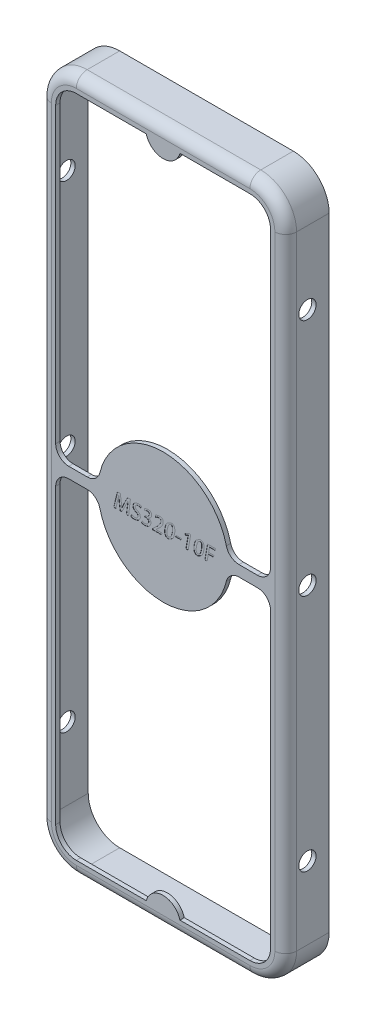
from build123d import *

# Parameters (mm, degrees)
BOSS_EXTRUDE1_DEPTH     = 2
FILLET1_R               = 0.5
SHELL1_T                = -0.2
CUT_EXTRUDE1_DEPTH      = 18.085739668
CUT_EXTRUDE2_DEPTH      = 18.08573968
CUT_EXTRUDE2_DEPTH_BACK = 18.08573968
SKETCH3_R               = 0.4
BOSS_EXTRUDE2_DEPTH     = 0.2
WRAP1_START             = -0.01
WRAP1_DEPTH             = 0.01


# Read off the part's stored shape, not the designer's step: Wrap1
with BuildPart() as part:
    # Sketch1 → Boss-Extrude1 (new body)
    with BuildSketch(Plane.XY):
        with BuildLine():
            Line((-4, 16), (4, 16))
            ThreePointArc((4, 16), (5.166726189, 15.516726189), (5.65, 14.35))
            Line((5.65, 14.35), (5.65, -14.35))
            ThreePointArc((5.65, -14.35), (5.166726189, -15.516726189), (4, -16))
            Line((4, -16), (-4, -16))
            ThreePointArc((-4, -16), (-5.166726189, -15.516726189), (-5.65, -14.35))
            Line((-5.65, -14.35), (-5.65, 14.35))
            ThreePointArc((-5.65, 14.35), (-5.166726189, 15.516726189), (-4, 16))
        make_face()
    extrude(amount=BOSS_EXTRUDE1_DEPTH)

    # Fillet1
    fillet1_edges = [part.edges().sort_by_distance(p)[0] for p in [
        (5.166726189, -15.516726189, 2),
        (5.65, 0, 2),
        (5.166726189, 15.516726189, 2),
        (0, 16, 2),
        (-5.166726189, 15.516726189, 2),
        (-5.65, 0, 2),
        (-5.166726189, -15.516726189, 2),
        (0, -16, 2),
    ]]
    fillet(fillet1_edges, radius=FILLET1_R)

    # Shell1
    shell1_openings = [part.faces().sort_by_distance(p)[0] for p in [
        (0, 0, 0),
    ]]
    offset(amount=SHELL1_T, openings=shell1_openings, kind=Kind.INTERSECTION)

    # Sketch2 → Cut-Extrude1 (cut, through all)
    with BuildSketch(Plane.XY.offset(2)):
        with BuildLine():
            Line((-4.35, 0.25), (-3.49821383, 0.25))
            ThreePointArc((-3.49821383, 0.25), (-3.127403906, 0.378300943), (-2.915178192, 0.708333333))
            ThreePointArc((-2.915178192, 0.708333333), (0, 3), (2.915178192, 0.708333333))
            ThreePointArc((2.915178192, 0.708333333), (3.127403906, 0.378300943), (3.49821383, 0.25))
            Line((3.49821383, 0.25), (4.35, 0.25))
            ThreePointArc((4.35, 0.25), (4.774264069, 0.425735931), (4.95, 0.85))
            Line((4.95, 0.85), (4.95, 14.35))
            ThreePointArc((4.95, 14.35), (4.671751442, 15.021751442), (4, 15.3))
            Line((4, 15.3), (-4, 15.3))
            ThreePointArc((-4, 15.3), (-4.671751442, 15.021751442), (-4.95, 14.35))
            Line((-4.95, 14.35), (-4.95, 0.85))
            ThreePointArc((-4.95, 0.85), (-4.774264069, 0.425735931), (-4.35, 0.25))
        make_face()
        with BuildLine():
            Line((-4, -15.3), (4, -15.3))
            ThreePointArc((4, -15.3), (4.671751442, -15.021751442), (4.95, -14.35))
            Line((4.95, -14.35), (4.95, -0.85))
            ThreePointArc((4.95, -0.85), (4.774264069, -0.425735931), (4.35, -0.25))
            Line((4.35, -0.25), (3.49821383, -0.25))
            ThreePointArc((3.49821383, -0.25), (3.127403906, -0.378300943), (2.915178192, -0.708333333))
            ThreePointArc((2.915178192, -0.708333333), (0, -3), (-2.915178192, -0.708333333))
            ThreePointArc((-2.915178192, -0.708333333), (-3.127403906, -0.378300943), (-3.49821383, -0.25))
            Line((-3.49821383, -0.25), (-4.35, -0.25))
            ThreePointArc((-4.35, -0.25), (-4.774264069, -0.425735931), (-4.95, -0.85))
            Line((-4.95, -0.85), (-4.95, -14.35))
            ThreePointArc((-4.95, -14.35), (-4.671751442, -15.021751442), (-4, -15.3))
        make_face()
    extrude(amount=-CUT_EXTRUDE1_DEPTH, mode=Mode.SUBTRACT)

    # Sketch3 → Cut-Extrude2 (cut, two sides: drawn at the far end of the back side and taken through both)
    with BuildSketch(Plane(origin=(0, 0, 0), x_dir=(0, 0, -1), z_dir=(1, 0, 0)).offset(-CUT_EXTRUDE2_DEPTH_BACK)):
        with Locations((-1, 0)):
            Circle(SKETCH3_R)
        with Locations((-1, 11)):
            Circle(SKETCH3_R)
        with Locations(Location((-1, -11, 0), (0, 0, 90))):
            Circle(SKETCH3_R)
    extrude(amount=CUT_EXTRUDE2_DEPTH + CUT_EXTRUDE2_DEPTH_BACK, mode=Mode.SUBTRACT)

    # Sketch4 → Boss-Extrude2 (add)
    with BuildSketch(Plane.XY.offset(2)):
        with BuildLine():
            Line((-0.8, 15.5), (0.8, 15.5))
            ThreePointArc((0.8, 15.5), (0, 14.7), (-0.8, 15.5))
        make_face()
        with BuildLine():
            Line((-0.8, -15.5), (0.8, -15.5))
            ThreePointArc((0.8, -15.5), (0, -14.7), (-0.8, -15.5))
        make_face()
    extrude(amount=-BOSS_EXTRUDE2_DEPTH)

    # Wrap1 outline → Wrap1 (cut)
    # profile 1 of 9: a face of its own
    with BuildSketch(Plane.XY.offset(2).offset(WRAP1_START)):
        with BuildLine():
            add(Edge.make_bspline(
                [(1.586144602, -0.357738226), (1.54802343, -0.351061654), (1.471618295, -0.337679999), (1.402972828, -0.1895203), (1.417919962, -0.079096155), (1.427910316, -0.005290942)],
                knots=[0, 0, 0, 0, 0.248239325, 0.497538725, 1, 1, 1, 1], degree=3))
            add(Edge.make_bspline(
                [(1.875397171, 0.002116467), (1.861269185, -0.074159773), (1.829992471, -0.243021071), (1.672497571, -0.317113852), (1.586144602, -0.357738226)],
                knots=[0, 0, 0, 0, 0.451709428, 1, 1, 1, 1], degree=3))
            add(Edge.make_bspline(
                [(1.718518836, 0.351851981), (1.756506472, 0.345450056), (1.832596862, 0.332626805), (1.900697575, 0.185099108), (1.885534609, 0.075434474), (1.875397171, 0.002116467)],
                knots=[0, 0, 0, 0, 0.248365009, 0.497482668, 1, 1, 1, 1], degree=3))
            add(Edge.make_bspline(
                [(1.427910316, -0.005290942), (1.442568806, 0.070496461), (1.475057404, 0.238469194), (1.632249849, 0.311675523), (1.718518836, 0.351851981)],
                knots=[0, 0, 0, 0, 0.451188722, 1, 1, 1, 1], degree=3))
        make_face()
        with BuildLine():
            add(Edge.make_bspline(
                [(1.535450019, -0.001587237), (1.528074164, -0.053457192), (1.517022814, -0.131174696), (1.531092484, -0.222447793), (1.562950436, -0.267960549), (1.589432881, -0.272348176), (1.602643344, -0.274536894)],
                knots=[0, 0, 0, 0, 0.501579369, 0.751523632, 0.876050416, 1, 1, 1, 1], degree=3))
            add(Edge.make_bspline(
                [(1.700132589, 0.268650908), (1.673725419, 0.258616582), (1.620239215, 0.238292631), (1.566744759, 0.133738649), (1.547970796, 0.052555576), (1.535450019, -0.001587237)],
                knots=[0, 0, 0, 0, 0.245176773, 0.496591442, 1, 1, 1, 1], degree=3))
            add(Edge.make_bspline(
                [(1.767725194, -0.001587237), (1.775036234, 0.049911485), (1.785987013, 0.127048403), (1.774270915, 0.219530589), (1.739705572, 0.262861041), (1.713326289, 0.266720556), (1.700132589, 0.268650908)],
                knots=[0, 0, 0, 0, 0.501619385, 0.751346284, 0.875634888, 1, 1, 1, 1], degree=3))
            add(Edge.make_bspline(
                [(1.602643344, -0.274536894), (1.630093794, -0.265403868), (1.685590896, -0.246939456), (1.736559298, -0.138207782), (1.755252722, -0.056262254), (1.767725194, -0.001587237)],
                knots=[0, 0, 0, 0, 0.245689514, 0.4967152, 1, 1, 1, 1], degree=3))
        make_face(mode=Mode.SUBTRACT)
    # profile 2 of 9: a face of its own
    with BuildSketch(Plane.XY.offset(2).offset(WRAP1_START)):
        with BuildLine():
            add(Edge.make_bspline(
                [(1.153743444, 0.243121544), (1.131869725, 0.232516701), (1.088613787, 0.211545306), (1.045718109, 0.189846597), (1.024513975, 0.17912052)],
                knots=[0, 0, 0, 0, 0.505681314, 1, 1, 1, 1], degree=3))
            Line((1.153743444, 0.243121544), (1.049440349, -0.348430783))
            Line((1.049440349, -0.348430783), (1.152572861, -0.349470899))
            Line((1.152572861, -0.349470899), (1.273292155, 0.335185182))
            Line((1.273292155, 0.335185182), (1.18369072, 0.335185182))
            Line((1.18369072, 0.335185182), (1.014324008, 0.256149485))
            Line((1.014324008, 0.256149485), (1.024513975, 0.17912052))
        make_face()
    # profile 3 of 9: a face of its own
    with BuildSketch(Plane.XY.offset(2).offset(WRAP1_START)):
        with BuildLine():
            add(Edge.make_bspline(
                [(0.240112607, -0.357738226), (0.201991436, -0.351061654), (0.1255863, -0.337679999), (0.056940833, -0.1895203), (0.071887967, -0.079096155), (0.081878322, -0.005290942)],
                knots=[0, 0, 0, 0, 0.248239325, 0.497538725, 1, 1, 1, 1], degree=3))
            add(Edge.make_bspline(
                [(0.529365177, 0.002116467), (0.51523719, -0.074159773), (0.483960476, -0.243021071), (0.326465576, -0.317113852), (0.240112607, -0.357738226)],
                knots=[0, 0, 0, 0, 0.451709428, 1, 1, 1, 1], degree=3))
            add(Edge.make_bspline(
                [(0.372486841, 0.351851981), (0.410474477, 0.345450056), (0.486564867, 0.332626805), (0.55466558, 0.185099108), (0.539502615, 0.075434474), (0.529365177, 0.002116467)],
                knots=[0, 0, 0, 0, 0.248365009, 0.497482668, 1, 1, 1, 1], degree=3))
            add(Edge.make_bspline(
                [(0.081878322, -0.005290942), (0.096536811, 0.070496461), (0.12902541, 0.238469194), (0.286217855, 0.311675523), (0.372486841, 0.351851981)],
                knots=[0, 0, 0, 0, 0.451188722, 1, 1, 1, 1], degree=3))
        make_face()
        with BuildLine():
            add(Edge.make_bspline(
                [(0.189418024, -0.001587237), (0.18204217, -0.053457192), (0.17099082, -0.131174696), (0.185060489, -0.222447793), (0.216918442, -0.267960549), (0.243400886, -0.272348176), (0.25661135, -0.274536894)],
                knots=[0, 0, 0, 0, 0.501579369, 0.751523632, 0.876050416, 1, 1, 1, 1], degree=3))
            add(Edge.make_bspline(
                [(0.354100594, 0.268650908), (0.327693424, 0.258616582), (0.274207221, 0.238292631), (0.220712764, 0.133738649), (0.201938802, 0.052555576), (0.189418024, -0.001587237)],
                knots=[0, 0, 0, 0, 0.245176773, 0.496591442, 1, 1, 1, 1], degree=3))
            add(Edge.make_bspline(
                [(0.4216932, -0.001587237), (0.42900424, 0.049911485), (0.439955019, 0.127048403), (0.42823892, 0.219530589), (0.393673577, 0.262861041), (0.367294294, 0.266720556), (0.354100594, 0.268650908)],
                knots=[0, 0, 0, 0, 0.501619385, 0.751346284, 0.875634888, 1, 1, 1, 1], degree=3))
            add(Edge.make_bspline(
                [(0.25661135, -0.274536894), (0.2840618, -0.265403868), (0.339558901, -0.246939456), (0.390527304, -0.138207782), (0.409220728, -0.056262254), (0.4216932, -0.001587237)],
                knots=[0, 0, 0, 0, 0.245689514, 0.4967152, 1, 1, 1, 1], degree=3))
        make_face(mode=Mode.SUBTRACT)
    # profile 4 of 9: a face of its own
    with BuildSketch(Plane.XY.offset(2).offset(WRAP1_START)):
        with BuildLine():
            add(Edge.make_bspline(
                [(-0.330199869, -0.264211165), (-0.284138068, -0.264986038), (-0.191909327, -0.266537552), (-0.099668052, -0.266226825), (-0.053494838, -0.266071284)],
                knots=[0, 0, 0, 0, 0.499430003, 1, 1, 1, 1], degree=3))
            Line((-0.330199869, -0.264211165), (-0.263181834, -0.205617016))
            add(Edge.make_bspline(
                [(0.005555557, 0.152381045), (-0.003528599, 0.120035968), (-0.021705689, 0.055314561), (-0.080567733, -0.027515999), (-0.16066342, -0.114754189), (-0.224453177, -0.171291521), (-0.263181834, -0.205617016)],
                knots=[0, 0, 0, 0, 0.21964169, 0.439495608, 0.659701123, 1, 1, 1, 1], degree=3))
            add(Edge.make_bspline(
                [(-0.163095268, 0.351851981), (-0.113958927, 0.345225704), (-0.003663784, 0.33035186), (0.002266954, 0.215864459), (0.005555557, 0.152381045)],
                knots=[0, 0, 0, 0, 0.445498688, 1, 1, 1, 1], degree=3))
            add(Edge.make_bspline(
                [(-0.359656151, 0.289947208), (-0.333017746, 0.305672002), (-0.27253695, 0.341374142), (-0.202362052, 0.348092618), (-0.163095268, 0.351851981)],
                knots=[0, 0, 0, 0, 0.440444019, 1, 1, 1, 1], degree=3))
            Line((-0.359656151, 0.289947208), (-0.340996312, 0.213842232))
            add(Edge.make_bspline(
                [(-0.19880956, 0.268650908), (-0.221471, 0.265661515), (-0.273042607, 0.258858425), (-0.316586401, 0.230012671), (-0.340996312, 0.213842232)],
                knots=[0, 0, 0, 0, 0.439416987, 1, 1, 1, 1], degree=3))
            add(Edge.make_bspline(
                [(-0.102380971, 0.141269932), (-0.09985859, 0.171840916), (-0.094256225, 0.239740953), (-0.161720225, 0.258395367), (-0.19880956, 0.268650908)],
                knots=[0, 0, 0, 0, 0.450235164, 1, 1, 1, 1], degree=3))
            add(Edge.make_bspline(
                [(-0.390608538, -0.212169287), (-0.337813551, -0.168435573), (-0.218818125, -0.069863488), (-0.144002801, 0.065797809), (-0.102380971, 0.141269932)],
                knots=[0, 0, 0, 0, 0.443672404, 1, 1, 1, 1], degree=3))
            Line((-0.390608538, -0.212169287), (-0.476064748, -0.287737929))
            Line((-0.476064748, -0.287737929), (-0.48691454, -0.349272616))
            Line((-0.48691454, -0.349272616), (-0.068164979, -0.349272616))
            Line((-0.068164979, -0.349272616), (-0.053494838, -0.266071284))
        make_face()
    # profile 5 of 9: a face of its own
    with BuildSketch(Plane.XY.offset(2).offset(WRAP1_START)):
        with BuildLine():
            add(Edge.make_bspline(
                [(-1.031084846, 0.245899581), (-1.04744454, 0.254255371), (-1.084627892, 0.273246942), (-1.126447726, 0.275727397), (-1.149867937, 0.277116518)],
                knots=[0, 0, 0, 0, 0.439973597, 1, 1, 1, 1], degree=3))
            Line((-1.031084846, 0.245899581), (-0.990482057, 0.330362306))
            add(Edge.make_bspline(
                [(-1.132407616, 0.360317591), (-1.11081601, 0.35969247), (-1.061821949, 0.358273991), (-1.016070765, 0.340373871), (-0.990482057, 0.330362306)],
                knots=[0, 0, 0, 0, 0.440698443, 1, 1, 1, 1], degree=3))
            add(Edge.make_bspline(
                [(-1.393386501, 0.171693218), (-1.372350469, 0.220939791), (-1.324467032, 0.333037699), (-1.201405862, 0.350517162), (-1.132407616, 0.360317591)],
                knots=[0, 0, 0, 0, 0.439317497, 1, 1, 1, 1], degree=3))
            add(Edge.make_bspline(
                [(-1.254100761, -0.029232745), (-1.291422592, -0.01156234), (-1.374623624, 0.027830043), (-1.38671758, 0.120559692), (-1.393386501, 0.171693218)],
                knots=[0, 0, 0, 0, 0.448574143, 1, 1, 1, 1], degree=3))
            add(Edge.make_bspline(
                [(-1.158465822, -0.160317425), (-1.159925664, -0.133205437), (-1.163280446, -0.070900861), (-1.221318249, -0.044273273), (-1.254100761, -0.029232745)],
                knots=[0, 0, 0, 0, 0.435152433, 1, 1, 1, 1], degree=3))
            add(Edge.make_bspline(
                [(-1.307010823, -0.266666651), (-1.276175431, -0.264135046), (-1.207107329, -0.258464513), (-1.17579744, -0.19528854), (-1.158465822, -0.160317425)],
                knots=[0, 0, 0, 0, 0.446449116, 1, 1, 1, 1], degree=3))
            add(Edge.make_bspline(
                [(-1.451455294, -0.225396802), (-1.431718932, -0.236211375), (-1.386866594, -0.260788287), (-1.335676021, -0.264556541), (-1.307010823, -0.266666651)],
                knots=[0, 0, 0, 0, 0.440029735, 1, 1, 1, 1], degree=3))
            Line((-1.451455294, -0.225396802), (-1.490964618, -0.314674395))
            add(Edge.make_bspline(
                [(-1.329365325, -0.357142858), (-1.354402242, -0.356027432), (-1.411124622, -0.353500377), (-1.46234988, -0.328589667), (-1.490964618, -0.314674395)],
                knots=[0, 0, 0, 0, 0.44139398, 1, 1, 1, 1], degree=3))
            add(Edge.make_bspline(
                [(-1.048941993, -0.15119044), (-1.070942552, -0.205046518), (-1.120962433, -0.327492251), (-1.254540013, -0.346497056), (-1.329365325, -0.357142858)],
                knots=[0, 0, 0, 0, 0.439836299, 1, 1, 1, 1], degree=3))
            add(Edge.make_bspline(
                [(-1.178836196, 0.056084731), (-1.141877375, 0.037182435), (-1.05927936, -0.005061666), (-1.052621027, -0.099183698), (-1.048941993, -0.15119044)],
                knots=[0, 0, 0, 0, 0.447454111, 1, 1, 1, 1], degree=3))
            add(Edge.make_bspline(
                [(-1.284259496, 0.183597982), (-1.285500013, 0.168145794), (-1.287978255, 0.13727618), (-1.247075332, 0.087902308), (-1.206180311, 0.068834357), (-1.178836196, 0.056084731)],
                knots=[0, 0, 0, 0, 0.249308666, 0.4980565, 1, 1, 1, 1], degree=3))
            add(Edge.make_bspline(
                [(-1.149867937, 0.277116518), (-1.177291494, 0.274860433), (-1.238772589, 0.269802498), (-1.268044359, 0.214328102), (-1.284259496, 0.183597982)],
                knots=[0, 0, 0, 0, 0.446048601, 1, 1, 1, 1], degree=3))
        make_face()
    # profile 6 of 9: a face of its own
    with BuildSketch(Plane.XY.offset(2).offset(WRAP1_START)):
        with BuildLine():
            add(Edge.make_bspline(
                [(-0.676077444, 0.018438498), (-0.642240081, 0.005601047), (-0.566069607, -0.023297032), (-0.563392639, -0.106608287), (-0.561904866, -0.152910017)],
                knots=[0, 0, 0, 0, 0.444232004, 1, 1, 1, 1], degree=3))
            add(Edge.make_bspline(
                [(-0.524603271, 0.183201157), (-0.53577814, 0.149462626), (-0.561123662, 0.07294086), (-0.634854572, 0.037983256), (-0.676077444, 0.018438498)],
                knots=[0, 0, 0, 0, 0.440901087, 1, 1, 1, 1], degree=3))
            add(Edge.make_bspline(
                [(-0.686772614, 0.351851981), (-0.642599193, 0.347817717), (-0.544407162, 0.338850048), (-0.531631549, 0.238439981), (-0.524603271, 0.183201157)],
                knots=[0, 0, 0, 0, 0.44986767, 1, 1, 1, 1], degree=3))
            add(Edge.make_bspline(
                [(-0.868254128, 0.302645623), (-0.843201714, 0.315306536), (-0.786272018, 0.344077492), (-0.722487944, 0.349061327), (-0.686772614, 0.351851981)],
                knots=[0, 0, 0, 0, 0.440058801, 1, 1, 1, 1], degree=3))
            Line((-0.868254128, 0.302645623), (-0.855426409, 0.225026587))
            add(Edge.make_bspline(
                [(-0.725264684, 0.268650908), (-0.745664343, 0.26641849), (-0.792048625, 0.26134247), (-0.832670118, 0.23806609), (-0.855426409, 0.225026587)],
                knots=[0, 0, 0, 0, 0.439796786, 1, 1, 1, 1], degree=3))
            add(Edge.make_bspline(
                [(-0.635582128, 0.165740836), (-0.635158684, 0.191543076), (-0.634206214, 0.249581062), (-0.692748717, 0.261841278), (-0.725264684, 0.268650908)],
                knots=[0, 0, 0, 0, 0.444575042, 1, 1, 1, 1], degree=3))
            add(Edge.make_bspline(
                [(-0.793518665, 0.047222296), (-0.761151503, 0.051954331), (-0.688480741, 0.062578698), (-0.654453706, 0.128937747), (-0.635582128, 0.165740836)],
                knots=[0, 0, 0, 0, 0.445394556, 1, 1, 1, 1], degree=3))
            Line((-0.793518665, 0.047222296), (-0.838295872, 0.047354442))
            Line((-0.838295872, 0.047354442), (-0.850050535, -0.019312237))
            Line((-0.850050535, -0.019312237), (-0.803421217, -0.019312237))
            add(Edge.make_bspline(
                [(-0.670105944, -0.149338587), (-0.668560281, -0.13096279), (-0.665486944, -0.09442506), (-0.709477705, -0.029644121), (-0.765849424, -0.023444374), (-0.803421217, -0.019312237)],
                knots=[0, 0, 0, 0, 0.252295277, 0.501654241, 1, 1, 1, 1], degree=3))
            add(Edge.make_bspline(
                [(-0.830158883, -0.274603161), (-0.796106694, -0.270523816), (-0.719427814, -0.261337928), (-0.687728156, -0.189354835), (-0.670105944, -0.149338587)],
                knots=[0, 0, 0, 0, 0.444088242, 1, 1, 1, 1], degree=3))
            add(Edge.make_bspline(
                [(-0.959523987, -0.235317439), (-0.941946543, -0.245409783), (-0.902003218, -0.268343822), (-0.855947398, -0.272356372), (-0.830158883, -0.274603161)],
                knots=[0, 0, 0, 0, 0.440059591, 1, 1, 1, 1], degree=3))
            Line((-0.959523987, -0.235317439), (-1.001052702, -0.315689969))
            add(Edge.make_bspline(
                [(-0.84034407, -0.357804234), (-0.865255566, -0.35681099), (-0.921706959, -0.354560221), (-0.972611744, -0.329622754), (-1.001052702, -0.315689969)],
                knots=[0, 0, 0, 0, 0.441291061, 1, 1, 1, 1], degree=3))
            add(Edge.make_bspline(
                [(-0.561904866, -0.152910017), (-0.584030825, -0.206097195), (-0.634329636, -0.327007287), (-0.766380886, -0.346747532), (-0.84034407, -0.357804234)],
                knots=[0, 0, 0, 0, 0.439890312, 1, 1, 1, 1], degree=3))
        make_face()
    # profile 7 of 9: a face of its own
    with BuildSketch(Plane.XY.offset(2).offset(WRAP1_START)):
        with BuildLine():
            add(Edge.make_bspline(
                [(-1.908694471, -0.19814812), (-1.892530213, -0.162304644), (-1.85598647, -0.081270624), (-1.817828484, -0.000983344), (-1.796548777, 0.043790763)],
                knots=[0, 0, 0, 0, 0.442326268, 1, 1, 1, 1], degree=3))
            add(Edge.make_bspline(
                [(-1.930291361, 0.042857215), (-1.926158277, 0.007597944), (-1.916765005, -0.072535883), (-1.91159157, -0.153056797), (-1.908694471, -0.19814812)],
                knots=[0, 0, 0, 0, 0.44000483, 1, 1, 1, 1], degree=3))
            Line((-1.930291361, 0.042857215), (-1.974535335, 0.351444176))
            Line((-1.974535335, 0.351444176), (-2.106194585, 0.351444176))
            Line((-2.106194585, 0.351444176), (-2.276960133, -0.347405392))
            Line((-2.276960133, -0.347405392), (-2.178215695, -0.347405392))
            Line((-2.178215695, -0.347405392), (-2.112117257, -0.060682843))
            add(Edge.make_bspline(
                [(-2.044381268, 0.235328032), (-2.054538062, 0.191844866), (-2.077561644, 0.093276544), (-2.099728983, -0.005488018), (-2.112117257, -0.060682843)],
                knots=[0, 0, 0, 0, 0.441147472, 1, 1, 1, 1], degree=3))
            add(Edge.make_bspline(
                [(-2.021164394, -0.032275074), (-2.026097605, 0.006837389), (-2.037309109, 0.09572667), (-2.041842583, 0.185215483), (-2.044381268, 0.235328032)],
                knots=[0, 0, 0, 0, 0.44001326, 1, 1, 1, 1], degree=3))
            Line((-2.021164394, -0.032275074), (-1.979598347, -0.341005289))
            Line((-1.979598347, -0.341005289), (-1.900054217, -0.341005289))
            Line((-1.900054217, -0.341005289), (-1.740256914, -0.025858308))
            add(Edge.make_bspline(
                [(-1.613745803, 0.235328032), (-1.632089782, 0.196672575), (-1.673564778, 0.10927415), (-1.716378999, 0.022523429), (-1.740256914, -0.025858308)],
                knots=[0, 0, 0, 0, 0.442290087, 1, 1, 1, 1], degree=3))
            add(Edge.make_bspline(
                [(-1.655952687, -0.055290951), (-1.650582515, -0.012546626), (-1.638378232, 0.08459436), (-1.622587974, 0.181219969), (-1.613745803, 0.235328032)],
                knots=[0, 0, 0, 0, 0.440023579, 1, 1, 1, 1], degree=3))
            Line((-1.655952687, -0.055290951), (-1.691807909, -0.347405392))
            Line((-1.691807909, -0.347405392), (-1.589406269, -0.347405392))
            Line((-1.589406269, -0.347405392), (-1.508242156, 0.351444176))
            Line((-1.508242156, 0.351444176), (-1.640815707, 0.351444176))
            Line((-1.640815707, 0.351444176), (-1.796548777, 0.043790763))
        make_face()
    # profile 8 of 9: a face of its own
    with BuildSketch(Plane.XY.offset(2).offset(WRAP1_START)):
        Polygon((2.045149988, 0.34345238), (1.922577291, -0.351715702), (2.028636132, -0.351715702), (2.082802809, -0.044510784), (2.322349501, -0.044510784), (2.337019642, 0.038690548), (2.09747295, 0.038690548), (2.136538687, 0.260251048), (2.394371386, 0.260251048), (2.409041527, 0.34345238), align=None)
    # profile 9 of 9: a face of its own
    with BuildSketch(Plane.XY.offset(2).offset(WRAP1_START)):
        Polygon((0.841357965, -0.03730153), (0.589925368, -0.03730153), (0.578170576, -0.103968338), (0.829603173, -0.103968338), align=None)
    extrude(amount=WRAP1_DEPTH, mode=Mode.SUBTRACT)


solid = part.part
